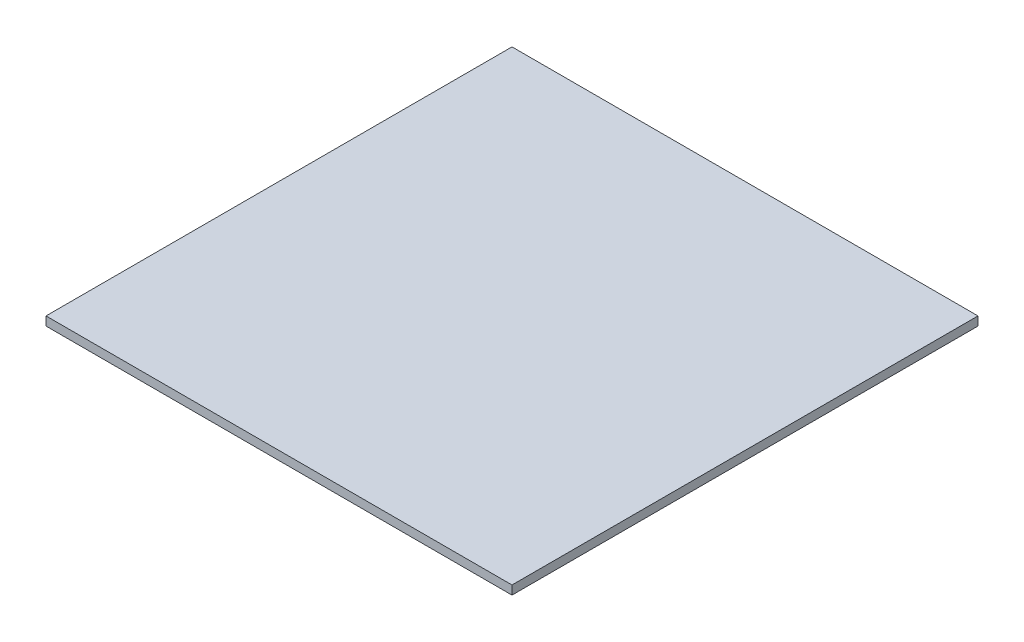
from build123d import *

# Parameters (mm, degrees)
SKETCH1_W           = 127
SKETCH1_H           = 127
BOSS_EXTRUDE1_DEPTH = 2.4


with BuildPart() as part:
    # Sketch1 → Boss-Extrude1 (new body)
    with BuildSketch(Plane(origin=(0, 0, 0), x_dir=(1, 0, 0), z_dir=(0, 1, 0))):
        Rectangle(SKETCH1_W, SKETCH1_H)
    extrude(amount=BOSS_EXTRUDE1_DEPTH)


solid = part.part
